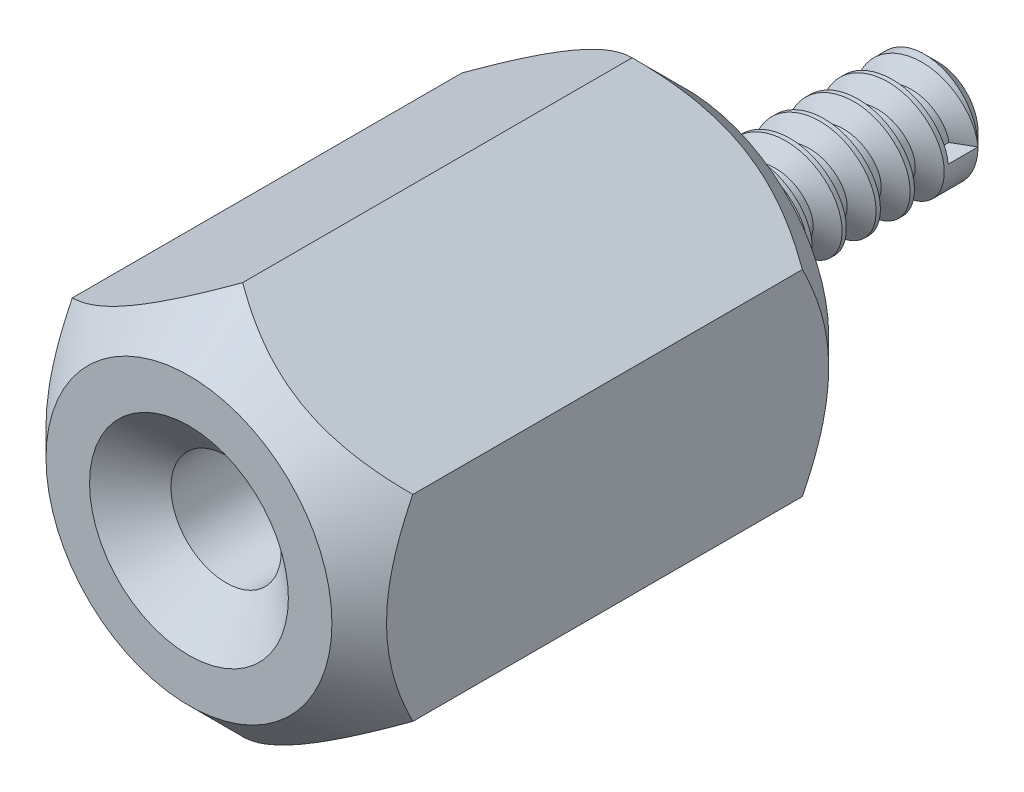
from build123d import *

# Parameters (mm, degrees)
BOSS_EXTRUDE1_DEPTH                               = 4.6325
BOSS_EXTRUDE1_DEPTH_BACK                          = 4.6325
CSK_FOR_1_FLAT_HEAD_MACHINE_SCREW_100_D           = 2.0574
CSK_FOR_1_FLAT_HEAD_MACHINE_SCREW_100_DEPTH       = 10
CSK_FOR_1_FLAT_HEAD_MACHINE_SCREW_100_CSINK_D     = 3.7084
CSK_FOR_1_FLAT_HEAD_MACHINE_SCREW_100_CSINK_ANGLE = 100
CSK_FOR_1_FLAT_HEAD_MACHINE_SCREW_100_TIP         = 0.618105319
SKETCH6_R                                         = 1
BOSS_EXTRUDE2_DEPTH                               = 4.7
CHAMFER1_SIZE                                     = 0.25
THREAD1_PITCH                                     = 0.635


with BuildPart() as part:
    # Sketch1 → Boss-Extrude1 (new, two sides: drawn at the far end of the back side and taken through both)
    with BuildSketch(Plane.XY.offset(-BOSS_EXTRUDE1_DEPTH_BACK)):
        Polygon((3.175, -1.833087105), (3.175, 1.833087105), (0, 3.666174209), (-3.175, 1.833087105), (-3.175, -1.833087105), (0, -3.666174209), align=None)
    extrude(amount=BOSS_EXTRUDE1_DEPTH + BOSS_EXTRUDE1_DEPTH_BACK)

    # Sketch3 → Cut-Revolve2 (revolve, cut)
    with BuildSketch(Plane(origin=(0, 0, 0), x_dir=(0, 0, -1), z_dir=(1, 0, 0)), mode=Mode.PRIVATE) as cut_revolve2_sk:
        Polygon((-3.6325, 3.666174209), (-4.6325, 2.666174209), (-4.6325, 3.666174209), align=None)
    cut_revolve2 = revolve(cut_revolve2_sk.sketch.rotate(Axis((0, 0, -0.635), (0, 0, 1)), 90), axis=Axis((0, 0, -0.635), (0, 0, 1)), mode=Mode.SUBTRACT)

    # Mirror1: Cut-Revolve2 across plane
    add(cut_revolve2.mirror(Plane.XY), mode=Mode.SUBTRACT)

    # CSK for #1 Flat Head Machine Screw (100)1
    with Locations(Plane.XY.offset(4.6325)):
        with Locations((0, 0)):
            CounterSinkHole(CSK_FOR_1_FLAT_HEAD_MACHINE_SCREW_100_D / 2, CSK_FOR_1_FLAT_HEAD_MACHINE_SCREW_100_CSINK_D / 2, depth=CSK_FOR_1_FLAT_HEAD_MACHINE_SCREW_100_DEPTH, counter_sink_angle=CSK_FOR_1_FLAT_HEAD_MACHINE_SCREW_100_CSINK_ANGLE)
            with Locations((0, 0, -(CSK_FOR_1_FLAT_HEAD_MACHINE_SCREW_100_DEPTH + CSK_FOR_1_FLAT_HEAD_MACHINE_SCREW_100_TIP / 2))):  # 118° drill point
                Cone(0, CSK_FOR_1_FLAT_HEAD_MACHINE_SCREW_100_D / 2, CSK_FOR_1_FLAT_HEAD_MACHINE_SCREW_100_TIP, mode=Mode.SUBTRACT)


with BuildPart() as body_2:
    # Sketch6 → Boss-Extrude2 (new body)
    with BuildSketch(Plane(origin=(0, 0, -4.6325), x_dir=(-1, 0, 0), z_dir=(0, 0, -1))):
        Circle(SKETCH6_R)
    extrude(amount=BOSS_EXTRUDE2_DEPTH)

    # Chamfer1
    chamfer1_edges = [body_2.edges().sort_by_distance(p)[0] for p in [
        (1, 0, -9.3325),
    ]]
    chamfer(chamfer1_edges, length=CHAMFER1_SIZE)

    # Thread1: the profile of Thread Profile1 profile screwed along a right-hand helix of 6.299213 turns, 6 arcs to a turn; built about Z, then put on its axis
    thread1_z = Axis((0, 0, 0), (0, 0, 1))
    thread1_corners = [(1.0003, 0, -0.000173205), (1.0003, 0, 0.555798203), (0.656296169, 0, 0.357187499), (0.656296169, 0, 0.198437499)]
    with BuildLine(mode=Mode.PRIVATE) as thread1_profile:
        Line(thread1_corners[0], thread1_corners[1])
        Line(thread1_corners[1], thread1_corners[2])
        Line(thread1_corners[2], thread1_corners[3])
        Line(thread1_corners[3], thread1_corners[0])
    thread1_cap = Face(thread1_profile.wire())
    thread1_turn_angles = [0, 30, 60, 90, 120, 150, 180, 210, 240, 270, 300, 330, 360]
    thread1_turn_weights = [1, 0.8660254037844387, 1, 0.8660254037844387, 1, 0.8660254037844387, 1, 0.8660254037844387, 1, 0.8660254037844387, 1, 0.8660254037844387, 1]
    thread1_turn_rails = [Edge.make_bspline([Vector(p[0], p[1], 0).rotate(thread1_z, thread1_turn_angles[k]) / thread1_turn_weights[k] + Vector(0, 0, p[2] + THREAD1_PITCH * thread1_turn_angles[k] / 360) for k in range(13)], [0, 0, 0, 1, 1, 2, 2, 3, 3, 4, 4, 5, 5, 6, 6, 6], 2, thread1_turn_weights) for p in thread1_corners]
    thread1_turn_sides = [Face.make_surface_from_curves(thread1_turn_rails[p[0]], thread1_turn_rails[p[1]]) for p in [(0, 1), (1, 2), (2, 3), (3, 0)]]
    thread1_last_angles = [2160, 2190, 2220, 2243.858267717, 2267.716535433]
    thread1_last_weights = [1, 0.8660254037844387, 1, 0.9145488039507501, 1]
    thread1_last_rails = [Edge.make_bspline([Vector(p[0], p[1], 0).rotate(thread1_z, thread1_last_angles[k]) / thread1_last_weights[k] + Vector(0, 0, p[2] + THREAD1_PITCH * thread1_last_angles[k] / 360) for k in range(5)], [0, 0, 0, 1, 1, 2, 2, 2], 2, thread1_last_weights) for p in thread1_corners]
    thread1_last_sides = [Face.make_surface_from_curves(thread1_last_rails[p[0]], thread1_last_rails[p[1]]) for p in [(0, 1), (1, 2), (2, 3), (3, 0)]]
    thread1 = Plane(origin=(0, 0, -9.0825), x_dir=(1, 0, 0), z_dir=(0, 0, 1)) * Solid(Shell([*[p.moved(Location((0, 0, THREAD1_PITCH * i))) for i in range(6) for p in thread1_turn_sides], *thread1_last_sides, thread1_cap, thread1_cap.rotate(thread1_z, 2267.716535433).moved(Location((0, 0, THREAD1_PITCH * 2267.716535433 / 360)))]))
    add(thread1, mode=Mode.SUBTRACT)


solid = Compound([part.part, body_2.part])
